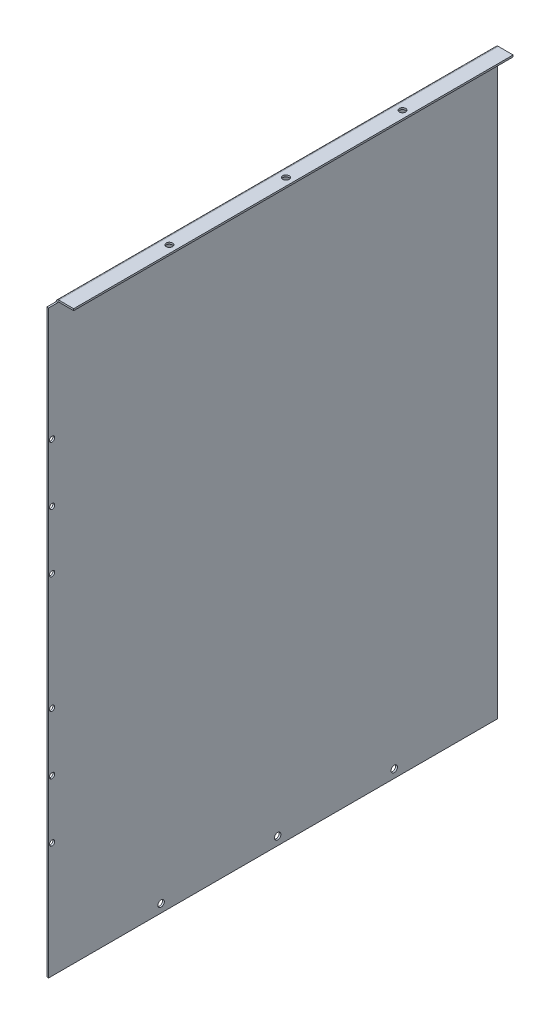
from build123d import *

# Parameters (mm, degrees)
SKETCH_1_W                       = 1.5
SKETCH_1_H                       = 500
SM_BASE_FLANGE_1_DEPTH           = 385
SM_EDGE_FLANGE_1_STRIP_W         = 7.4732
SM_EDGE_FLANGE_1_STRIP_H         = 1.5
SM_EDGE_FLANGE_1_STRIP_CUT_DEPTH = 385
SM_EDGE_FLANGE_1_DEPTH           = 385
SKETCH_12_W                      = 16.530990935
SKETCH_12_H                      = 8.400471009
CUT_EXTRUDE_1_DEPTH              = 8
SKETCH_13_R                      = 2.75
CUT_EXTRUDE_2_DEPTH              = 20
SKETCH_14_R                      = 2.75
CUT_EXTRUDE_3_DEPTH              = 10
SKETCH_15_R                      = 2.25
CUT_EXTRUDE_4_DEPTH              = 10


# Sheet-metal steps are written as plain solids
with BuildPart() as part:
    # Sketch 1 → 基体-法兰1 (new body)
    with BuildSketch(Plane.XY):
        with Locations((0.75, 250)):
            Rectangle(SKETCH_1_W, SKETCH_1_H)
    extrude(amount=SM_BASE_FLANGE_1_DEPTH)

    # 边线-法兰1 strip (across the edge) → 边线-法兰1 strip cut (cut)
    with BuildSketch(Plane(origin=(1.5, 500, 0), x_dir=(0, -1, 0), z_dir=(0, 0, 1))):
        with Locations((-1.5, -0.75)):
            Rectangle(SM_EDGE_FLANGE_1_STRIP_W, SM_EDGE_FLANGE_1_STRIP_H)
    extrude(amount=SM_EDGE_FLANGE_1_STRIP_CUT_DEPTH, mode=Mode.SUBTRACT)

    # 边线-法兰1 section (across the edge) → 边线-法兰1 (add)
    with BuildSketch(Plane(origin=(1.5, 500, 0), x_dir=(0, -1, 0), z_dir=(0, 0, 1))):
        with BuildLine():
            Line((0, 0.7366), (0, 13.5))
            Line((0, 13.5), (1.5, 13.5))
            Line((1.5, 13.5), (1.5, 0.7366))
            ThreePointArc((1.5, 0.7366), (1.715745145, 0.215745145), (2.2366, 0))
            Line((2.2366, 0), (2.2366, -1.5))
            ThreePointArc((2.2366, -1.5), (0.655084973, -0.844915027), (0, 0.7366))
        make_face()
    extrude(amount=SM_EDGE_FLANGE_1_DEPTH)

    # 草图12 → 切除-拉伸1 (cut)
    with BuildSketch(Plane.XY.offset(385)):
        with Locations((8.265495468, 501.963635505)):
            Rectangle(SKETCH_12_W, SKETCH_12_H)
    extrude(amount=-CUT_EXTRUDE_1_DEPTH, mode=Mode.SUBTRACT)

    # 草图13 → 切除-拉伸2 (cut)
    with BuildSketch(Plane(origin=(1.5, 0, 0), x_dir=(0, 0, -1), z_dir=(1, 0, 0))):
        with Locations((-288.5, 7.1183)):
            Circle(SKETCH_13_R)
        with Locations((-188.5, 7.1183)):
            Circle(SKETCH_13_R)
        with Locations((-88.5, 7.1183)):
            Circle(SKETCH_13_R)
    extrude(amount=-CUT_EXTRUDE_2_DEPTH, mode=Mode.SUBTRACT)

    # 草图14 → 切除-拉伸3 (cut)
    with BuildSketch(Plane.XZ.offset(-498.5)):
        with Locations(Location((8.6183, 88.5, 0), (0, 0, 270))):
            Circle(SKETCH_14_R)
        with Locations(Location((8.6183, 188.5, 0), (0, 0, 270))):
            Circle(SKETCH_14_R)
        with Locations(Location((8.6183, 288.5, 0), (0, 0, 90))):
            Circle(SKETCH_14_R)
    extrude(amount=-CUT_EXTRUDE_3_DEPTH, mode=Mode.SUBTRACT)

    # 草图15 → 切除-拉伸4 (cut)
    with BuildSketch(Plane.ZY):
        with Locations((382, 98.8817)):
            Circle(SKETCH_15_R)
        with Locations((382, 148.8817)):
            Circle(SKETCH_15_R)
        with Locations((382, 198.8817)):
            Circle(SKETCH_15_R)
        with Locations((382, 298.8817)):
            Circle(SKETCH_15_R)
        with Locations((382, 348.8817)):
            Circle(SKETCH_15_R)
        with Locations((382, 398.8817)):
            Circle(SKETCH_15_R)
    extrude(amount=-CUT_EXTRUDE_4_DEPTH, mode=Mode.SUBTRACT)


solid = part.part
